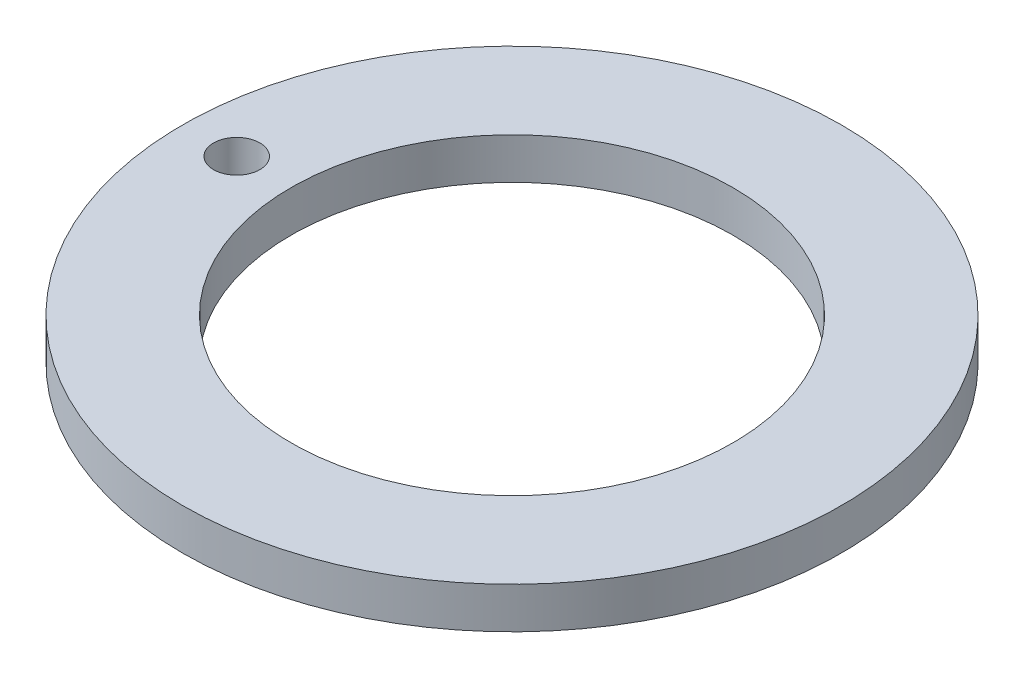
from build123d import *

# Parameters (mm, degrees)
CENTERING_RING_PROFILE_R   = 76.2
CENTERING_RING_PROFILE_R_2 = 51.1048
CENTERING_RING_BODY_DEPTH  = 9.525
EYE_BOLT_HOLE_PROFILE_R    = 5.35813
EYE_BOLT_HOLE_CUT_DEPTH    = 109.183203987


with BuildPart() as part:
    # Centering Ring Profile → Centering Ring Body (new body)
    with BuildSketch(Plane(origin=(0, 0, 0), x_dir=(1, 0, 0), z_dir=(0, 1, 0))):
        Circle(CENTERING_RING_PROFILE_R)
        Circle(CENTERING_RING_PROFILE_R_2, mode=Mode.SUBTRACT)
    extrude(amount=CENTERING_RING_BODY_DEPTH)

    # Eye Bolt Hole Profile → Eye Bolt Hole cut (cut, through all)
    with BuildSketch(Plane(origin=(0, 9.525, 0), x_dir=(1, 0, 0), z_dir=(0, 1, 0))):
        with Locations((-63.6524, 0)):
            Circle(EYE_BOLT_HOLE_PROFILE_R)
    extrude(amount=-EYE_BOLT_HOLE_CUT_DEPTH, mode=Mode.SUBTRACT)


solid = part.part
